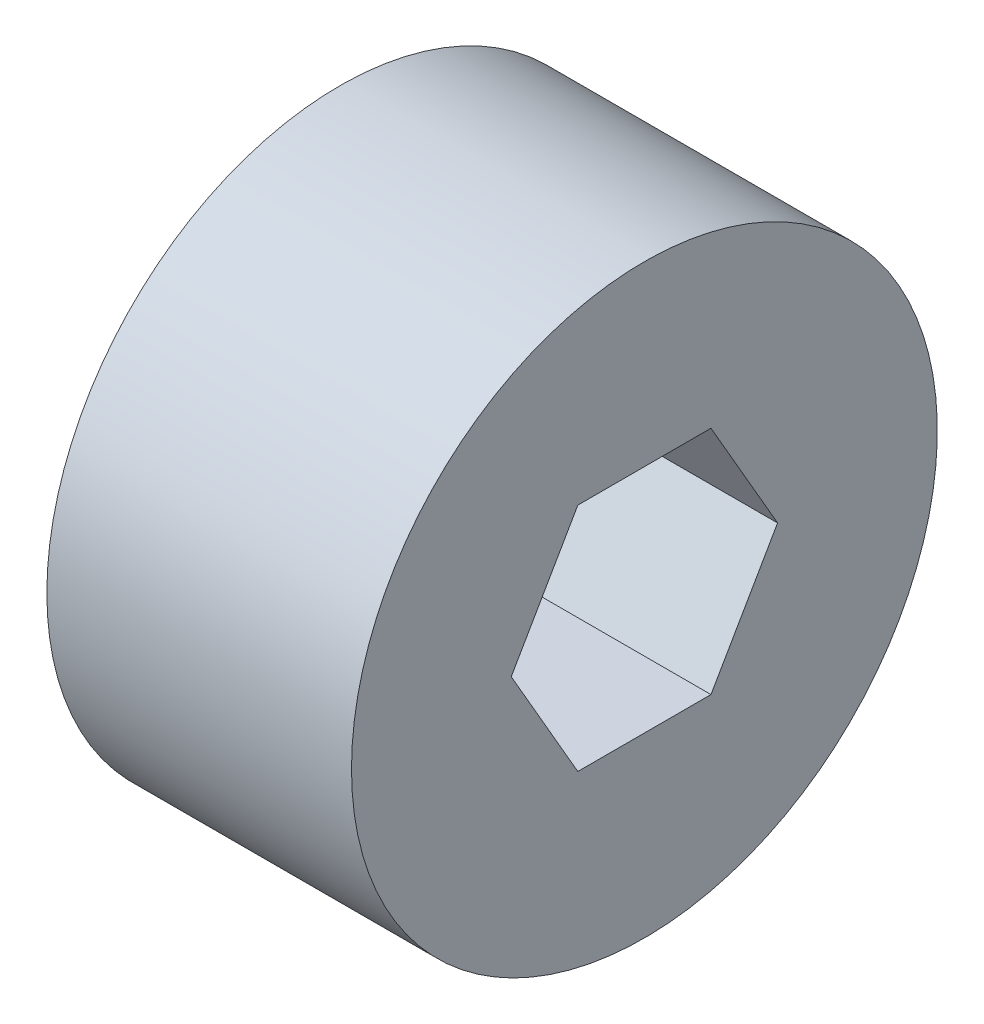
from build123d import *

# Parameters (mm, degrees)
SKETCH1_R           = 6.35
BOSS_EXTRUDE1_DEPTH = 6.604


with BuildPart() as part:
    # Sketch1 → Boss-Extrude1 (new body)
    with BuildSketch(Plane(origin=(0, 0, 0), x_dir=(0, 0, -1), z_dir=(1, 0, 0))):
        Circle(SKETCH1_R)
        Polygon((2.886751346, 0), (1.443375673, 2.5), (-1.443375673, 2.5), (-2.886751346, 0), (-1.443375673, -2.5), (1.443375673, -2.5), align=None, mode=Mode.SUBTRACT)
    extrude(amount=BOSS_EXTRUDE1_DEPTH)


solid = part.part
